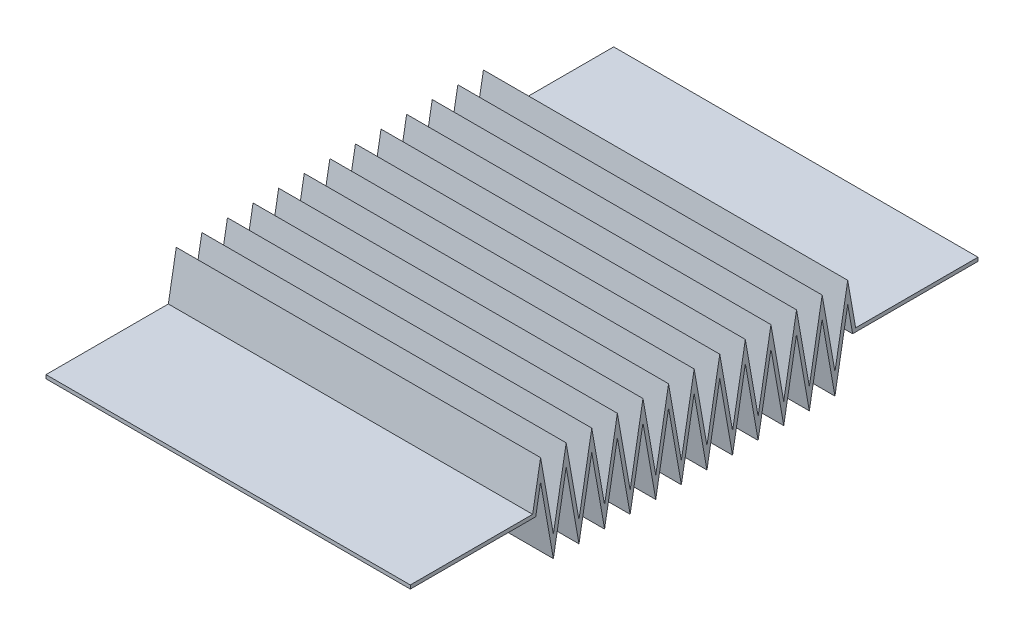
from build123d import *

# Parameters (mm, degrees)
EXTRUDE_THIN1_DEPTH = 25


with BuildPart() as part:
    # Sketch3 → Extrude-Thin1 (new, symmetric)
    with BuildSketch(Plane(origin=(0, 0, 0), x_dir=(0, 0, -1), z_dir=(1, 0, 0))):
        Polygon((0, 4.75), (17.209914233, 4.75), (17.878264157, 8.554948196), (19.634792472, -1.445051804), (21.391320786, 8.554948196), (23.147849101, -1.445051804), (24.904377415, 8.554948196), (26.66090573, -1.445051804), (28.417434045, 8.554948196), (30.173962359, -1.445051804), (31.930490674, 8.554948196), (33.687018988, -1.445051804), (35.443547303, 8.554948196), (37.200075617, -1.445051804), (38.956603932, 8.554948196), (40.713132246, -1.445051804), (42.469660561, 8.554948196), (44.226188875, -1.445051804), (45.98271719, 8.554948196), (47.739245505, -1.445051804), (49.495773819, 8.554948196), (51.252302134, -1.445051804), (53.008830448, 8.554948196), (54.765358763, -1.445051804), (56.521887077, 8.554948196), (58.278415392, -1.445051804), (60.034943706, 8.554948196), (60.70329363, 4.75), (77.913207864, 4.75), (77.913207864, 5.25), (61.123122097, 5.25), (60.034943706, 11.445051804), (58.278415392, 1.445051804), (56.521887077, 11.445051804), (54.765358763, 1.445051804), (53.008830448, 11.445051804), (51.252302134, 1.445051804), (49.495773819, 11.445051804), (47.739245505, 1.445051804), (45.98271719, 11.445051804), (44.226188875, 1.445051804), (42.469660561, 11.445051804), (40.713132246, 1.445051804), (38.956603932, 11.445051804), (37.200075617, 1.445051804), (35.443547303, 11.445051804), (33.687018988, 1.445051804), (31.930490674, 11.445051804), (30.173962359, 1.445051804), (28.417434045, 11.445051804), (26.66090573, 1.445051804), (24.904377415, 11.445051804), (23.147849101, 1.445051804), (21.391320786, 11.445051804), (19.634792472, 1.445051804), (17.878264157, 11.445051804), (16.790085767, 5.25), (0, 5.25), align=None)
    extrude(amount=EXTRUDE_THIN1_DEPTH, both=True)


solid = part.part
